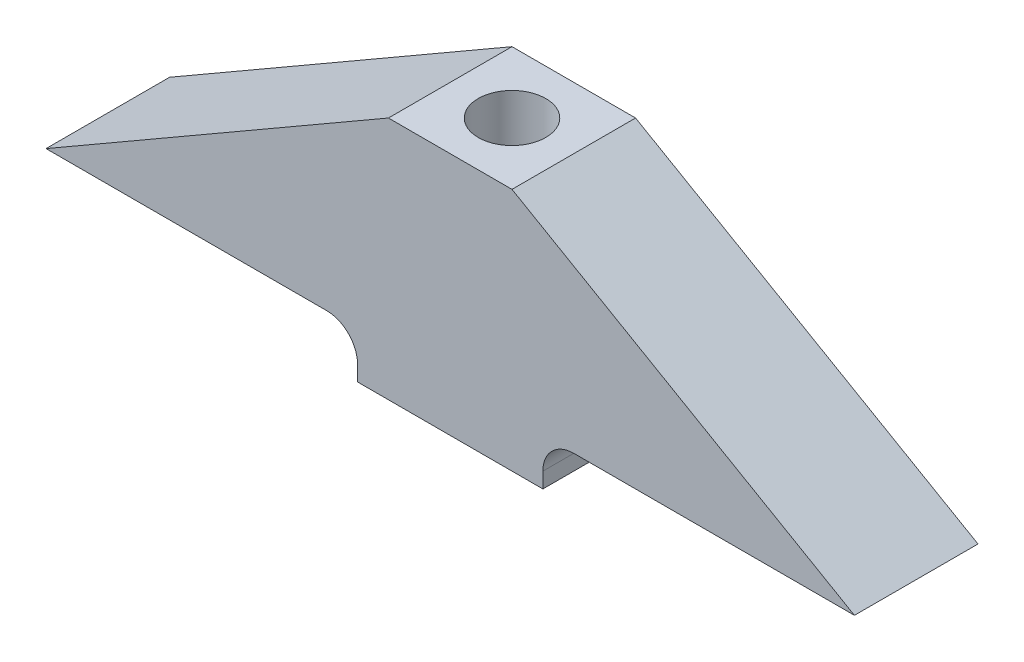
from build123d import *

# Parameters (mm, degrees)
BOSS_EXTRUDE1_DEPTH                  = 25.4
F_35_64_0_54688_DIAMETER_HOLE1_D     = 13.890752
F_35_64_0_54688_DIAMETER_HOLE1_DEPTH = 35.052
F_35_64_0_54688_DIAMETER_HOLE1_TIP   = 4.173202923
F_10_32_TAPPED_HOLE1_D               = 4.0386
F_10_32_TAPPED_HOLE1_DEPTH           = 8.636
F_10_32_TAPPED_HOLE1_TIP             = 1.213317848
FILLET1_R                            = 6.35


with BuildPart() as part:
    # Sketch1 → Boss-Extrude1 (new body)
    with BuildSketch(Plane.XY):
        Polygon((0, 0), (64.04054482, 0), (64.04054482, -9.525), (102.14054482, -9.525), (102.14054482, 0), (166.181089639, 0), (95.79054482, 40.64), (70.39054482, 40.64), align=None)
    extrude(amount=BOSS_EXTRUDE1_DEPTH)

    # 35/64 (0.54688) Diameter Hole1
    with Locations(Plane(origin=(0, 40.64, 0), x_dir=(1, 0, 0), z_dir=(0, 1, 0))):
        with Locations((83.09054482, -12.7)):
            Hole(F_35_64_0_54688_DIAMETER_HOLE1_D / 2, depth=F_35_64_0_54688_DIAMETER_HOLE1_DEPTH)
            with Locations((0, 0, -(F_35_64_0_54688_DIAMETER_HOLE1_DEPTH + F_35_64_0_54688_DIAMETER_HOLE1_TIP / 2))):  # 118° drill point
                Cone(0, F_35_64_0_54688_DIAMETER_HOLE1_D / 2, F_35_64_0_54688_DIAMETER_HOLE1_TIP, mode=Mode.SUBTRACT)

    # #10-32 Tapped Hole1
    with Locations(Plane(origin=(0, -9.525, 0), x_dir=(-1, 0, 0), z_dir=(0, -1, 0))):
        with Locations((-92.61554482, -15.875), (-73.56554482, -9.525)):
            Hole(F_10_32_TAPPED_HOLE1_D / 2, depth=F_10_32_TAPPED_HOLE1_DEPTH)
            with Locations((0, 0, -(F_10_32_TAPPED_HOLE1_DEPTH + F_10_32_TAPPED_HOLE1_TIP / 2))):  # 118° drill point
                Cone(0, F_10_32_TAPPED_HOLE1_D / 2, F_10_32_TAPPED_HOLE1_TIP, mode=Mode.SUBTRACT)

    # Fillet1
    fillet1_edges = [part.edges().sort_by_distance(p)[0] for p in [
        (102.14054482, 0, 12.7),
        (64.04054482, 0, 12.7),
    ]]
    fillet(fillet1_edges, radius=FILLET1_R)


solid = part.part
